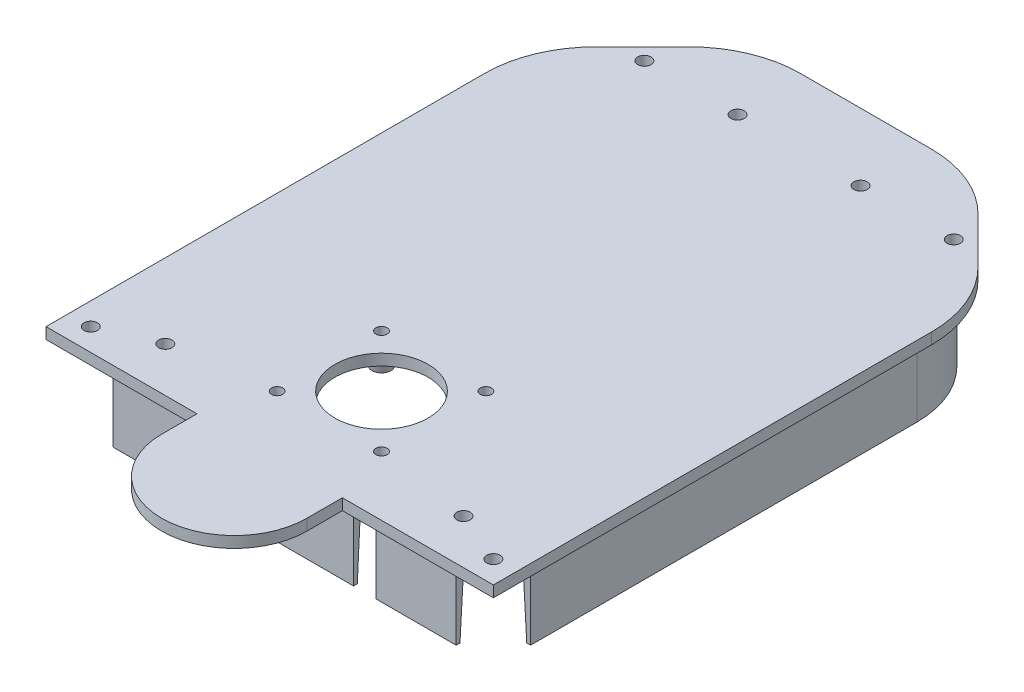
from build123d import *
from OCP.BRepFilletAPI import BRepFilletAPI_MakeChamfer

# Parameters (mm, degrees)
BOSS_EXTRUDE1_DEPTH                                 = 3
FILLET1_R                                           = 30
BOSS_EXTRUDE2_DEPTH                                 = 20
CHAMFER2_SIZE                                       = 1
CHAMFER2_SIZE_2                                     = 20
CUT_EXTRUDE1_REACH                                  = 170.333
SKETCH3_W                                           = 6
SKETCH3_H                                           = 18
FILLET2_R                                           = 2
FILLET2_OF_MIRROR1_R                                = 2
CUT_EXTRUDE7_REACH                                  = 103.98
SKETCH14_R                                          = 10
SKETCH14_R_2                                        = 8
M3_CLEARANCE_HOLE1_D                                = 3.6
SKETCH18_R                                          = 4
BOSS_EXTRUDE5_DEPTH                                 = 4
FILLET6_R                                           = 2
FILLET6_OF_MIRROR5_R                                = 2
CBORE_FOR_M3_HEX_SOCKET_HEAD_CAP_SCREW1_D           = 3.6
CBORE_FOR_M3_HEX_SOCKET_HEAD_CAP_SCREW1_CBORE_D     = 6.5
CBORE_FOR_M3_HEX_SOCKET_HEAD_CAP_SCREW1_CBORE_DEPTH = 3.4
CUT_EXTRUDE4_REACH                                  = 170.333
SKETCH7_W                                           = 6
SKETCH7_H                                           = 11
BOSS_EXTRUDE3_DEPTH                                 = 4
CUT_EXTRUDE5_REACH                                  = 104.611
SKETCH10_R                                          = 12.5
SKETCH11_R                                          = 3.5
BOSS_EXTRUDE4_DEPTH                                 = 5
F_3_0MM_DOWEL_HOLE1_D                               = 3
F_3_0MM_DOWEL_HOLE1_DEPTH                           = 10
F_3_0MM_DOWEL_HOLE1_TIP                             = 0.901290929
CHAMFER3_SIZE                                       = 5
CHAMFER3_SIZE_2                                     = 1
BOSS_EXTRUDE6_DEPTH                                 = 3


with BuildPart() as part:
    # Sketch1 → Boss-Extrude1 (new body)
    with BuildSketch(Plane(origin=(0, 0, 0), x_dir=(1, 0, 0), z_dir=(0, 1, 0))):
        Polygon((-60, 50), (-30, 80), (30, 80), (60, 50), (60, -80), (-60, -80), align=None)
    extrude(amount=BOSS_EXTRUDE1_DEPTH)

    # Fillet1
    fillet1_edges = [part.edges().sort_by_distance(p)[0] for p in [
        (-60, 1.5, -50),
        (-30, 1.5, -80),
        (30, 1.5, -80),
        (60, 1.5, -50),
    ]]
    fillet(fillet1_edges, radius=FILLET1_R)

    # Sketch2 → Boss-Extrude2 (add)
    with BuildSketch(Plane.XZ):
        with BuildLine():
            Line((-56, 76), (-56, -37.573593129))
            ThreePointArc((-56, -37.573593129), (-54.020867845, -47.52336237), (-48.384776311, -55.95836944))
            Line((-48.384776311, -55.95836944), (-35.95836944, -68.384776311))
            ThreePointArc((-35.95836944, -68.384776311), (-27.52336237, -74.020867845), (-17.573593129, -76))
            Line((-17.573593129, -76), (17.573593129, -76))
            ThreePointArc((17.573593129, -76), (27.52336237, -74.020867845), (35.95836944, -68.384776311))
            Line((35.95836944, -68.384776311), (48.384776311, -55.95836944))
            ThreePointArc((48.384776311, -55.95836944), (54.020867845, -47.52336237), (56, -37.573593129))
            Line((56, -37.573593129), (56, 76))
            Line((56, 76), (-56, 76))
        make_face()
        with BuildLine():
            Line((54, 74), (-54, 74))
            Line((-54, 74), (-54, -37.573593129))
            ThreePointArc((-54, -37.573593129), (-52.17310878, -46.757995506), (-46.970562748, -54.544155877))
            Line((-46.970562748, -54.544155877), (-34.544155877, -66.970562748))
            ThreePointArc((-34.544155877, -66.970562748), (-26.757995506, -72.17310878), (-17.573593129, -74))
            Line((-17.573593129, -74), (17.573593129, -74))
            ThreePointArc((17.573593129, -74), (26.757995506, -72.17310878), (34.544155877, -66.970562748))
            Line((34.544155877, -66.970562748), (46.970562748, -54.544155877))
            ThreePointArc((46.970562748, -54.544155877), (52.17310878, -46.757995506), (54, -37.573593129))
            Line((54, -37.573593129), (54, 74))
        make_face(mode=Mode.SUBTRACT)
    extrude(amount=BOSS_EXTRUDE2_DEPTH)

    # Chamfer2
    # the kernel refuses this chamfer: 20, 1 mm, written as the material it takes off along each edge
    with BuildSketch(Plane(origin=(-54, -20, 74), x_dir=(-1, 0, 0), z_dir=(0, 0, -1)), Plane(origin=(54, -20, -37.573593129), x_dir=(1, 0, 0), z_dir=(0, 0, 1))) as chamfer2_piece_1:
        Polygon((CHAMFER2_SIZE, 0), (0, CHAMFER2_SIZE_2), (0, 0), align=None)
    extrude(amount=111.573593129, mode=Mode.SUBTRACT)
    with BuildSketch(Plane(origin=(-30, -20, -37.573593129), x_dir=(-1, 0, 0), z_dir=(0, 0, 1))) as chamfer2_piece_2:
        Polygon((24 + CHAMFER2_SIZE, 0), (24, -CHAMFER2_SIZE_2), (24, 0), align=None)
    revolve(axis=Axis((-30, -20, -37.573593129), (0, -1, 0)), revolution_arc=45, mode=Mode.SUBTRACT)
    with BuildSketch(Plane(origin=(-46.970562748, -20, -54.544155877), x_dir=(-0.7071067811865482, 0, -0.7071067811865469), z_dir=(0.7071067811865469, 0, -0.7071067811865481)), Plane(origin=(34.544155877, -20, -66.970562748), x_dir=(0.7071067811865481, 0, -0.7071067811865468), z_dir=(0.7071067811865469, 0, 0.7071067811865481))) as chamfer2_piece_3:
        Polygon((CHAMFER2_SIZE, 0), (0, CHAMFER2_SIZE_2), (0, 0), align=None)
    extrude(amount=17.573593129, mode=Mode.SUBTRACT)
    with BuildSketch(Plane(origin=(-17.573593129, -20, -50), x_dir=(-0.7071067811865478, 0, -0.7071067811865472), z_dir=(-0.7071067811865472, 0, 0.7071067811865478))) as chamfer2_piece_4:
        Polygon((24 + CHAMFER2_SIZE, 0), (24, -CHAMFER2_SIZE_2), (24, 0), align=None)
    revolve(axis=Axis((-17.573593129, -20, -50), (0, -1, 0)), revolution_arc=45, mode=Mode.SUBTRACT)
    with BuildSketch(Plane(origin=(-17.573593129, -20, -74), x_dir=(0, 0, -1), z_dir=(1, 0, 0))) as chamfer2_piece_5:
        Polygon((CHAMFER2_SIZE, 0), (0, CHAMFER2_SIZE_2), (0, 0), align=None)
    extrude(amount=35.147186258, mode=Mode.SUBTRACT)
    with BuildSketch(Plane(origin=(17.573593129, -20, -50), x_dir=(0, 0, -1), z_dir=(-1, 0, 0))) as chamfer2_piece_6:
        Polygon((24 + CHAMFER2_SIZE, 0), (24, -CHAMFER2_SIZE_2), (24, 0), align=None)
    revolve(axis=Axis((17.573593129, -20, -50), (0, -1, 0)), revolution_arc=45, mode=Mode.SUBTRACT)
    with BuildSketch(Plane(origin=(30, -20, -37.573593129), x_dir=(0.7071067811865482, 0, -0.7071067811865468), z_dir=(-0.7071067811865468, 0, -0.7071067811865482))) as chamfer2_piece_7:
        Polygon((24 + CHAMFER2_SIZE, 0), (24, -CHAMFER2_SIZE_2), (24, 0), align=None)
    revolve(axis=Axis((30, -20, -37.573593129), (0, -1, 0)), revolution_arc=45, mode=Mode.SUBTRACT)
    with BuildSketch(Plane(origin=(54, -20, 74), x_dir=(0, 0, 1), z_dir=(-1, 0, 0))) as chamfer2_piece_8:
        Polygon((CHAMFER2_SIZE, 0), (0, CHAMFER2_SIZE_2), (0, 0), align=None)
    extrude(amount=108, mode=Mode.SUBTRACT)
    with BuildSketch(Plane(origin=(-54, -20, 125.997600596), x_dir=(-1, 0, 0), z_dir=(0, 0, -1))) as chamfer2_piece_9a_section:
        Polygon((CHAMFER2_SIZE, 0), (0, CHAMFER2_SIZE_2), (0, 0), align=None)
    chamfer2_piece_9a = extrude(amount=163.571193725, mode=Mode.PRIVATE)
    chamfer2_piece_9a = split(chamfer2_piece_9a, bisect_by=Plane(origin=(-54, -20, 76), z_dir=(0, 0, -1)), keep=Keep.TOP, mode=Mode.PRIVATE)
    chamfer2_piece_9a = split(chamfer2_piece_9a, bisect_by=Plane(origin=(-54, -20, 74), z_dir=(0, 0, 1)), keep=Keep.TOP, mode=Mode.PRIVATE)
    with BuildSketch(Plane(origin=(54, -20, 74), x_dir=(0, 0, 1), z_dir=(-1, 0, 0))) as chamfer2_piece_9b_section:
        Polygon((CHAMFER2_SIZE, 0), (0, CHAMFER2_SIZE_2), (0, 0), align=None)
    chamfer2_piece_9b = extrude(amount=159.997600596, mode=Mode.PRIVATE)
    chamfer2_piece_9b = split(chamfer2_piece_9b, bisect_by=Plane(origin=(-56, -20, 74), z_dir=(1, 0, 0)), keep=Keep.TOP, mode=Mode.PRIVATE)
    chamfer2_piece_9b = split(chamfer2_piece_9b, bisect_by=Plane(origin=(-54, -20, 74), z_dir=(-1, 0, 0)), keep=Keep.TOP, mode=Mode.PRIVATE)
    chamfer2_piece_9 = chamfer2_piece_9a & chamfer2_piece_9b
    add(chamfer2_piece_9, mode=Mode.SUBTRACT)
    with BuildSketch(Plane(origin=(54, -20, -37.573593129), x_dir=(1, 0, 0), z_dir=(0, 0, 1))) as chamfer2_piece_10a_section:
        Polygon((CHAMFER2_SIZE, 0), (0, CHAMFER2_SIZE_2), (0, 0), align=None)
    chamfer2_piece_10a = extrude(amount=163.571193725, mode=Mode.PRIVATE)
    chamfer2_piece_10a = split(chamfer2_piece_10a, bisect_by=Plane(origin=(54, -20, 76), z_dir=(0, 0, -1)), keep=Keep.TOP, mode=Mode.PRIVATE)
    chamfer2_piece_10a = split(chamfer2_piece_10a, bisect_by=Plane(origin=(54, -20, 74), z_dir=(0, 0, 1)), keep=Keep.TOP, mode=Mode.PRIVATE)
    with BuildSketch(Plane(origin=(105.997600596, -20, 74), x_dir=(0, 0, 1), z_dir=(-1, 0, 0))) as chamfer2_piece_10b_section:
        Polygon((CHAMFER2_SIZE, 0), (0, CHAMFER2_SIZE_2), (0, 0), align=None)
    chamfer2_piece_10b = extrude(amount=159.997600596, mode=Mode.PRIVATE)
    chamfer2_piece_10b = split(chamfer2_piece_10b, bisect_by=Plane(origin=(56, -20, 74), z_dir=(-1, 0, 0)), keep=Keep.TOP, mode=Mode.PRIVATE)
    chamfer2_piece_10b = split(chamfer2_piece_10b, bisect_by=Plane(origin=(54, -20, 74), z_dir=(1, 0, 0)), keep=Keep.TOP, mode=Mode.PRIVATE)
    chamfer2_piece_10 = chamfer2_piece_10a & chamfer2_piece_10b
    add(chamfer2_piece_10, mode=Mode.SUBTRACT)

    # Cut-Extrude1: up to this plane
    cut_extrude1_end = Plane(origin=(54, 0, 74), z_dir=(0, 0.049937616943888354, 0.9987523388778449))
    # Sketch3 → Cut-Extrude1 (cut, up to the surface)
    with BuildSketch(Plane.XY.offset(76), mode=Mode.PRIVATE) as cut_extrude1_sk1:
        with Locations((-21.5, -11)):
            Rectangle(SKETCH3_W, SKETCH3_H)
    cut_extrude1_tool1 = split(extrude(cut_extrude1_sk1.sketch, amount=-CUT_EXTRUDE1_REACH, mode=Mode.PRIVATE), bisect_by=cut_extrude1_end, keep=Keep.BOTH, mode=Mode.PRIVATE)
    cut_extrude1 = cut_extrude1_tool1.solids().sort_by_distance((-21.5, -11, 76))[0]
    add(cut_extrude1, mode=Mode.SUBTRACT)

    # Fillet2
    fillet2_edges = [part.edges().sort_by_distance(p)[0] for p in [
        (-24.5, -2, 75.05),
        (-18.5, -2, 75.05),
    ]]
    fillet(fillet2_edges, radius=FILLET2_R)

    # Mirror1: Cut-Extrude1 across plane
    add(cut_extrude1.mirror(Plane(origin=(0, 0, 0), x_dir=(0, 0, 1), z_dir=(1, 0, 0))), mode=Mode.SUBTRACT)

    # Fillet2 of Mirror1
    fillet2_of_mirror1_edges = [part.edges().sort_by_distance(p)[0] for p in [
        (24.5, -2, 75.05),
        (18.5, -2, 75.05),
    ]]
    fillet(fillet2_of_mirror1_edges, radius=FILLET2_OF_MIRROR1_R)

    # Sketch14 → Cut-Extrude7 (cut, up to next)
    with BuildSketch(Plane.XZ, mode=Mode.PRIVATE) as cut_extrude7_sk1:
        with Locations((-56, 76)):
            Circle(SKETCH14_R)
    cut_extrude7_tool1 = extrude(cut_extrude7_sk1.sketch, amount=CUT_EXTRUDE7_REACH, mode=Mode.PRIVATE) & part.part
    # Sketch14 → Cut-Extrude7 (cut, up to next)
    with BuildSketch(Plane.XZ, mode=Mode.PRIVATE) as cut_extrude7_sk2:
        with Locations((-40.757359313, -60.757359313)):
            Circle(SKETCH14_R_2)
    cut_extrude7_tool2 = extrude(cut_extrude7_sk2.sketch, amount=CUT_EXTRUDE7_REACH, mode=Mode.PRIVATE) & part.part
    cut_extrude7_1 = cut_extrude7_tool1.solids().sort_by_distance((-56, 0, 76))[0]
    add(cut_extrude7_1, mode=Mode.SUBTRACT)
    cut_extrude7_2 = cut_extrude7_tool2.solids().sort_by_distance((-40.757359, 0, -60.757359))[0]
    add(cut_extrude7_2, mode=Mode.SUBTRACT)
    cut_extrude7 = cut_extrude7_1 + cut_extrude7_2  # Cut-Extrude7 as one shape, for the pattern or mirror that repeats it

    # M3 Clearance Hole1 (through all)
    with Locations(Plane(origin=(0, 3, 0), x_dir=(1, 0, 0), z_dir=(0, 1, 0))):
        with Locations((-54, -74), (-41.5, 62)):
            m3_clearance_hole1 = Hole(M3_CLEARANCE_HOLE1_D / 2)

    # Sketch18 → Boss-Extrude5 (add)
    with BuildSketch(Plane.XZ):
        with Locations(Location((-16.5, -62, 0), (0, 0, 90))):
            Circle(SKETCH18_R)
        with Locations(Location((-40, 68, 0), (0, 0, 90))):
            Circle(SKETCH18_R)
    boss_extrude5 = extrude(amount=BOSS_EXTRUDE5_DEPTH)

    # Fillet6
    fillet6_edges = [part.edges().sort_by_distance(p)[0] for p in [
        (-16.5, 0, -66),
        (-40, 0, 64),
    ]]
    fillet(fillet6_edges, radius=FILLET6_R - 0.0001)  # a hair under: the kernel refuses the full size

    # Mirror5: Cut-Extrude7, M3 Clearance Hole1, Boss-Extrude5 across plane
    add(cut_extrude7.mirror(Plane(origin=(0, 0, 0), x_dir=(0, 0, 1), z_dir=(1, 0, 0))), mode=Mode.SUBTRACT)
    add(m3_clearance_hole1.mirror(Plane(origin=(0, 0, 0), x_dir=(0, 0, 1), z_dir=(1, 0, 0))), mode=Mode.SUBTRACT)
    add(boss_extrude5.mirror(Plane(origin=(0, 0, 0), x_dir=(0, 0, 1), z_dir=(1, 0, 0))))

    # Fillet6 of Mirror5
    fillet6_of_mirror5_edges = [part.edges().sort_by_distance(p)[0] for p in [
        (16.5, 0, -66),
        (40, 0, 64),
    ]]
    fillet(fillet6_of_mirror5_edges, radius=FILLET6_OF_MIRROR5_R - 0.0001)  # a hair under: the kernel refuses the full size

    # CBORE for M3 Hex Socket Head Cap Screw1 (through all)
    with Locations(Plane(origin=(0, -4, 0), x_dir=(-1, 0, 0), z_dir=(0, -1, 0))):
        with Locations((16.5, 62), (-16.5, 62), (-40, -68), (40, -68)):
            CounterBoreHole(CBORE_FOR_M3_HEX_SOCKET_HEAD_CAP_SCREW1_D / 2, CBORE_FOR_M3_HEX_SOCKET_HEAD_CAP_SCREW1_CBORE_D / 2, CBORE_FOR_M3_HEX_SOCKET_HEAD_CAP_SCREW1_CBORE_DEPTH)

    # Cut-Extrude4: up to this plane
    cut_extrude4_end = Plane(origin=(-17.573593129, 0, -74), z_dir=(0, 0.0499376169438892, -0.9987523388778449))
    # Sketch6 → Cut-Extrude4 (cut, up to the surface)
    with BuildSketch(Plane(origin=(0, 0, -76), x_dir=(-1, 0, 0), z_dir=(0, 0, -1)), mode=Mode.PRIVATE) as cut_extrude4_sk1:
        with BuildLine():
            Line((-10.583005244, -20), (10.583005244, -20))
            ThreePointArc((10.583005244, -20), (0, -12), (-10.583005244, -20))
        make_face()
    cut_extrude4_tool1 = split(extrude(cut_extrude4_sk1.sketch, amount=-CUT_EXTRUDE4_REACH, mode=Mode.PRIVATE), bisect_by=cut_extrude4_end, keep=Keep.BOTH, mode=Mode.PRIVATE)
    add(cut_extrude4_tool1.solids().sort_by_distance((0, -16.673049, -76))[0], mode=Mode.SUBTRACT)

    # Sketch7 → Boss-Extrude3 (add)
    with BuildSketch(Plane(origin=(0, 0, -76), x_dir=(-1, 0, 0), z_dir=(0, 0, -1))):
        with Locations((0, -5.5)):
            Rectangle(SKETCH7_W, SKETCH7_H)
    extrude(amount=BOSS_EXTRUDE3_DEPTH)

    # Sketch10 → Cut-Extrude5 (cut, up to next)
    with BuildSketch(Plane(origin=(0, 3, 0), x_dir=(1, 0, 0), z_dir=(0, 1, 0)), mode=Mode.PRIVATE) as cut_extrude5_sk1:
        with Locations(Location((0, -50, 0), (0, 0, 270))):
            Circle(SKETCH10_R)
    cut_extrude5_tool1 = extrude(cut_extrude5_sk1.sketch, amount=-CUT_EXTRUDE5_REACH, mode=Mode.PRIVATE) & part.part
    add(cut_extrude5_tool1.solids().sort_by_distance((0, 3, 50))[0], mode=Mode.SUBTRACT)

    # Sketch11 → Boss-Extrude4 (add)
    with BuildSketch(Plane.XZ):
        with Locations(Location((-14, 64, 0), (0, 0, 90))):
            Circle(SKETCH11_R)
        with Locations(Location((14, 64, 0), (0, 0, 90))):
            Circle(SKETCH11_R)
        with Locations(Location((14, 36, 0), (0, 0, 90))):
            Circle(SKETCH11_R)
        with Locations(Location((-14, 36, 0), (0, 0, 90))):
            Circle(SKETCH11_R)
    extrude(amount=BOSS_EXTRUDE4_DEPTH)

    # Ø3.0mm Dowel Hole1
    with Locations(Plane(origin=(0, -5, 0), x_dir=(-1, 0, 0), z_dir=(0, -1, 0))):
        with Locations((14, -64), (-14, -64), (-14, -36), (14, -36)):
            Hole(F_3_0MM_DOWEL_HOLE1_D / 2, depth=F_3_0MM_DOWEL_HOLE1_DEPTH)
            with Locations((0, 0, -(F_3_0MM_DOWEL_HOLE1_DEPTH + F_3_0MM_DOWEL_HOLE1_TIP / 2))):  # 118° drill point
                Cone(0, F_3_0MM_DOWEL_HOLE1_D / 2, F_3_0MM_DOWEL_HOLE1_TIP, mode=Mode.SUBTRACT)

    # Chamfer3
    chamfer3_edges_1 = [part.edges().sort_by_distance(p)[0] for p in [
        (-14, -5, 60.5),
    ]]
    chamfer3_side_1 = [part.faces().sort_by_distance(p)[0] for p in [
        (-14, -4.98, 60.5),
    ]]
    chamfer3_edges_2 = [part.edges().sort_by_distance(p)[0] for p in [
        (14, -5, 60.5),
    ]]
    chamfer3_side_2 = [part.faces().sort_by_distance(p)[0] for p in [
        (14, -4.98, 60.5),
    ]]
    chamfer3_edges_3 = [part.edges().sort_by_distance(p)[0] for p in [
        (14, -5, 32.5),
    ]]
    chamfer3_side_3 = [part.faces().sort_by_distance(p)[0] for p in [
        (14, -4.98, 32.5),
    ]]
    chamfer3_edges_4 = [part.edges().sort_by_distance(p)[0] for p in [
        (-14, -5, 32.5),
    ]]
    chamfer3_side_4 = [part.faces().sort_by_distance(p)[0] for p in [
        (-14, -4.98, 32.5),
    ]]
    chamfer3 = BRepFilletAPI_MakeChamfer(part.part.solid().wrapped)
    for e in chamfer3_edges_1:
        chamfer3.Add(CHAMFER3_SIZE - 0.0001, CHAMFER3_SIZE_2 - 0.0001, e.wrapped, chamfer3_side_1[0].wrapped)
    for e in chamfer3_edges_2:
        chamfer3.Add(CHAMFER3_SIZE - 0.0001, CHAMFER3_SIZE_2 - 0.0001, e.wrapped, chamfer3_side_2[0].wrapped)
    for e in chamfer3_edges_3:
        chamfer3.Add(CHAMFER3_SIZE - 0.0001, CHAMFER3_SIZE_2 - 0.0001, e.wrapped, chamfer3_side_3[0].wrapped)
    for e in chamfer3_edges_4:
        chamfer3.Add(CHAMFER3_SIZE - 0.0001, CHAMFER3_SIZE_2 - 0.0001, e.wrapped, chamfer3_side_4[0].wrapped)
    add(Compound.cast(chamfer3.Shape()), mode=Mode.REPLACE)  # a hair under: the kernel refuses the full size

    # Fillet5: read off the stored shape, not the designer's step
    # Fillet5 outline → Fillet5 (revolve)
    with BuildSketch(Plane(origin=(-14, 0, 36), x_dir=(1, 0, 0), z_dir=(0, 0, 1))):
        with BuildLine():
            ThreePointArc((3.178446454, -1.60776773), (3.871629994, -0.453315717), (5.139607805, 0))
            Line((5.139607805, 0), (3.178446454, 0))
            Line((3.178446454, 0), (3.178446454, -1.60776773))
        make_face()
    revolve(axis=Axis((-14, 0, 36), (0, 1, 0)))

    # Fillet5 2 outline → Fillet5 2 (revolve)
    with BuildSketch(Plane(origin=(14, 0, 36), x_dir=(1, 0, 0), z_dir=(0, 0, 1))):
        with BuildLine():
            ThreePointArc((3.178446454, -1.60776773), (3.871629994, -0.453315717), (5.139607805, 0))
            Line((5.139607805, 0), (3.178446454, 0))
            Line((3.178446454, 0), (3.178446454, -1.60776773))
        make_face()
    revolve(axis=Axis((14, 0, 36), (0, 1, 0)))

    # Fillet5 3 outline → Fillet5 3 (revolve)
    with BuildSketch(Plane(origin=(14, 0, 64), x_dir=(1, 0, 0), z_dir=(0, 0, 1))):
        with BuildLine():
            ThreePointArc((3.178446454, -1.60776773), (3.871629994, -0.453315717), (5.139607805, 0))
            Line((5.139607805, 0), (3.178446454, 0))
            Line((3.178446454, 0), (3.178446454, -1.60776773))
        make_face()
    revolve(axis=Axis((14, 0, 64), (0, 1, 0)))

    # Fillet5 4 outline → Fillet5 4 (revolve)
    with BuildSketch(Plane(origin=(-14, 0, 64), x_dir=(1, 0, 0), z_dir=(0, 0, 1))):
        with BuildLine():
            ThreePointArc((3.178446454, -1.60776773), (3.871629994, -0.453315717), (5.139607805, 0))
            Line((5.139607805, 0), (3.178446454, 0))
            Line((3.178446454, 0), (3.178446454, -1.60776773))
        make_face()
    revolve(axis=Axis((-14, 0, 64), (0, 1, 0)))

    # Sketch24 → Boss-Extrude6 (add)
    with BuildSketch(Plane(origin=(0, 3, 0), x_dir=(1, 0, 0), z_dir=(0, 1, 0))):
        with BuildLine():
            Line((-19.5, -80), (19.5, -80))
            Line((19.5, -80), (19.5, -89.5))
            ThreePointArc((19.5, -89.5), (0, -109), (-19.5, -89.5))
            Line((-19.5, -89.5), (-19.5, -80))
        make_face()
    extrude(amount=-BOSS_EXTRUDE6_DEPTH)


solid = part.part
